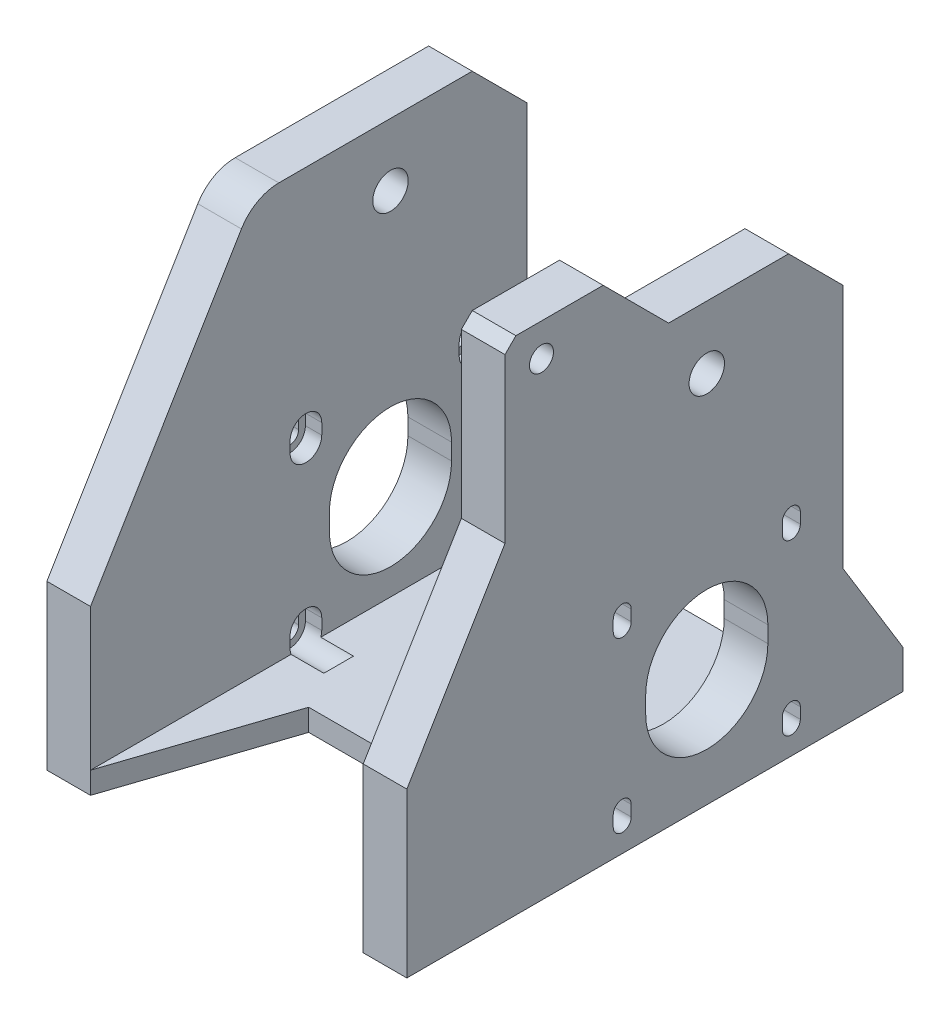
from build123d import *

# Parameters (mm, degrees)
EXTRUDE_1_DEPTH     = 50
SKETCH_3_R          = 6
CUT_EXTRUDE_1_DEPTH = 50
SKETCH_4_R          = 1.8
CUT_EXTRUDE_2_DEPTH = 28
CHAMFER_1_SIZE      = 1.5
CUT_EXTRUDE_3_DEPTH = 12
CUT_EXTRUDE_START   = -5
CUT_EXTRUDE_4_DEPTH = 9
SKETCH_10_R         = 3.25
CUT_EXTRUDE_5_DEPTH = 80
CHAMFER_2_SIZE      = 6
SKETCH_11_R         = 2.2
EXTRUDE_2_DEPTH     = 8
EXTRUDE_3_DEPTH     = 8
EXTRUDE_4_DEPTH     = 4
EXTRUDE_6_DEPTH     = 8
CHAMFER_3_SIZE      = 10
CHAMFER_4_SIZE      = 12
CHAMFER_5_SIZE      = 2
FILLET_1_R          = 8
SKETCH_17_R         = 4.05
CUT_EXTRUDE_6_DEPTH = 3
FILLET_2_R          = 0.5


with BuildPart() as part:
    # 草图1 → 凸台-拉伸1 (new body)
    with BuildSketch(Plane.XY):
        Polygon((33, 0), (-33, 0), (-33, 80), (-25, 80), (-25, 4), (25, 4), (25, 80), (33, 80), align=None)
    extrude(amount=EXTRUDE_1_DEPTH)

    # 草图3 → 切除-拉伸1 (cut)
    with BuildSketch(Plane.XZ):
        with Locations(Location((0, 25, 0), (0, 0, 270))):
            Circle(SKETCH_3_R)
    extrude(amount=-CUT_EXTRUDE_1_DEPTH, mode=Mode.SUBTRACT)

    # 草图4 → 切除-拉伸2 (cut)
    with BuildSketch(Plane.XZ):
        with Locations(Location((0, 40, 0), (0, 0, 270))):
            Circle(SKETCH_4_R)
        with Locations(Location((15, 25, 0), (0, 0, 270))):
            Circle(SKETCH_4_R)
        with Locations(Location((0, 10, 0), (0, 0, 270))):
            Circle(SKETCH_4_R)
        with Locations(Location((-15, 25, 0), (0, 0, 270))):
            Circle(SKETCH_4_R)
    extrude(amount=-CUT_EXTRUDE_2_DEPTH, mode=Mode.SUBTRACT)

    # 倒角1
    chamfer_1_edges = [part.edges().sort_by_distance(p)[0] for p in [
        (0, 4, 41.8),
        (15, 4, 26.8),
        (0, 4, 11.8),
        (-15, 4, 26.8),
    ]]
    chamfer(chamfer_1_edges, length=CHAMFER_1_SIZE)

    # 草图6 → 切除-拉伸3 (cut)
    with BuildSketch(Plane.ZY.offset(33)):
        with BuildLine():
            Line((13.8, 20), (13.8, 23))
            ThreePointArc((13.8, 23), (25, 34.2), (36.2, 23))
            Line((36.2, 23), (36.2, 20))
            ThreePointArc((36.2, 20), (25, 8.8), (13.8, 20))
        make_face()
        with BuildLine():
            Line((11.15, 38), (11.15, 36))
            ThreePointArc((11.15, 36), (9.5, 34.35), (7.85, 36))
            Line((7.85, 36), (7.85, 38))
            ThreePointArc((7.85, 38), (9.5, 39.65), (11.15, 38))
        make_face()
        with BuildLine():
            Line((38.85, 38), (38.85, 36))
            ThreePointArc((38.85, 36), (40.5, 34.35), (42.15, 36))
            Line((42.15, 36), (42.15, 38))
            ThreePointArc((42.15, 38), (40.5, 39.65), (38.85, 38))
        make_face()
        with BuildLine():
            Line((11.15, 5), (11.15, 7))
            ThreePointArc((11.15, 7), (9.5, 8.65), (7.85, 7))
            Line((7.85, 7), (7.85, 5))
            ThreePointArc((7.85, 5), (9.5, 3.35), (11.15, 5))
        make_face()
        with BuildLine():
            Line((38.85, 5), (38.85, 7))
            ThreePointArc((38.85, 7), (40.5, 8.65), (42.15, 7))
            Line((42.15, 7), (42.15, 5))
            ThreePointArc((42.15, 5), (40.5, 3.35), (38.85, 5))
        make_face()
    cut_extrude_3 = extrude(amount=-CUT_EXTRUDE_3_DEPTH, mode=Mode.SUBTRACT)

    # 草图9 → 切除-拉伸4 (cut)
    with BuildSketch(Plane.ZY.offset(33).offset(CUT_EXTRUDE_START)):
        with BuildLine():
            Line((12.4, 38), (12.4, 36))
            ThreePointArc((12.4, 36), (9.5, 33.1), (6.6, 36))
            Line((6.6, 36), (6.6, 38))
            ThreePointArc((6.6, 38), (9.5, 40.9), (12.4, 38))
        make_face()
        with BuildLine():
            Line((37.6, 38), (37.6, 36))
            ThreePointArc((37.6, 36), (40.5, 33.1), (43.4, 36))
            Line((43.4, 36), (43.4, 38))
            ThreePointArc((43.4, 38), (40.5, 40.9), (37.6, 38))
        make_face()
        with BuildLine():
            Line((37.6, 5), (37.6, 7))
            ThreePointArc((37.6, 7), (40.5, 9.9), (43.4, 7))
            Line((43.4, 7), (43.4, 5))
            ThreePointArc((43.4, 5), (40.5, 2.1), (37.6, 5))
        make_face()
        with BuildLine():
            Line((12.4, 5), (12.4, 7))
            ThreePointArc((12.4, 7), (9.5, 9.9), (6.6, 7))
            Line((6.6, 7), (6.6, 5))
            ThreePointArc((6.6, 5), (9.5, 2.1), (12.4, 5))
        make_face()
    cut_extrude_4 = extrude(amount=-CUT_EXTRUDE_4_DEPTH, mode=Mode.SUBTRACT)

    # 镜向1: 切除-拉伸3, 切除-拉伸4 across plane
    add(cut_extrude_3.mirror(Plane(origin=(0, 0, 0), x_dir=(0, 0, 1), z_dir=(1, 0, 0))), mode=Mode.SUBTRACT)
    add(cut_extrude_4.mirror(Plane(origin=(0, 0, 0), x_dir=(0, 0, 1), z_dir=(1, 0, 0))), mode=Mode.SUBTRACT)

    # 草图10 → 切除-拉伸5 (cut)
    with BuildSketch(Plane(origin=(33, 0, 0), x_dir=(0, 0, -1), z_dir=(1, 0, 0))):
        with Locations(Location((-25, 68.5, 0), (0, 0, 90))):
            Circle(SKETCH_10_R)
    extrude(amount=-CUT_EXTRUDE_5_DEPTH, mode=Mode.SUBTRACT)

    # 倒角2
    chamfer_2_edges = [part.edges().sort_by_distance(p)[0] for p in [
        (29, 80, 50),
    ]]
    chamfer(chamfer_2_edges, length=CHAMFER_2_SIZE)

    # 草图11 → 凸台-拉伸2 (add)
    with BuildSketch(Plane(origin=(33, 0, 0), x_dir=(0, 0, -1), z_dir=(1, 0, 0))):
        Polygon((-50, 63.445571485), (-50, 74), (-44, 80), (-44, 92), (-62, 92), (-62, 74), (-62, 54.790404535), (-50, 54.790404535), align=None)
        with Locations(Location((-55.310889132, 86, 0), (0, 0, 90))):
            Circle(SKETCH_11_R, mode=Mode.SUBTRACT)
    extrude(amount=-EXTRUDE_2_DEPTH)

    # 草图13 → 凸台-拉伸3 (add)
    with BuildSketch(Plane.ZY.offset(33)):
        Polygon((50, 80), (80, 30), (80, 0), (50, 0), align=None)
    extrude_3 = extrude(amount=-EXTRUDE_3_DEPTH)

    # 镜向2: 凸台-拉伸3 across plane
    add(extrude_3.mirror(Plane(origin=(0, 0, 0), x_dir=(0, 0, 1), z_dir=(1, 0, 0))))

    # 草图14 → 凸台-拉伸4 (add)
    with BuildSketch(Plane.XZ):
        Polygon((-25, 80), (-15, 50), (-25, 50), align=None)
    extrude_4 = extrude(amount=-EXTRUDE_4_DEPTH)

    # 镜向3: 凸台-拉伸4 across plane
    add(extrude_4.mirror(Plane(origin=(0, 0, 0), x_dir=(0, 0, 1), z_dir=(1, 0, 0))))

    # 草图16 → 凸台-拉伸6 (add)
    with BuildSketch(Plane.ZY.offset(33)):
        Polygon((0, 25), (-11, 7), (-11, 0), (0, 0), align=None)
    extrude_6 = extrude(amount=-EXTRUDE_6_DEPTH)

    # 镜向5: 凸台-拉伸6 across plane
    add(extrude_6.mirror(Plane(origin=(0, 0, 0), x_dir=(0, 0, 1), z_dir=(1, 0, 0))))

    # 倒角3
    chamfer_3_edges = [part.edges().sort_by_distance(p)[0] for p in [
        (29, 80, 0),
        (-29, 80, 0),
    ]]
    chamfer(chamfer_3_edges, length=CHAMFER_3_SIZE)

    # 倒角4
    chamfer_4_edges = [part.edges().sort_by_distance(p)[0] for p in [
        (29, 80, 44),
    ]]
    chamfer(chamfer_4_edges, length=CHAMFER_4_SIZE - 0.0001)  # a hair under: the kernel refuses the full size

    # 倒角5
    chamfer_5_edges = [part.edges().sort_by_distance(p)[0] for p in [
        (29, 92, 62),
    ]]
    chamfer(chamfer_5_edges, length=CHAMFER_5_SIZE)

    # 圆角1
    fillet_1_edges = [part.edges().sort_by_distance(p)[0] for p in [
        (-29, 80, 50),
    ]]
    fillet(fillet_1_edges, radius=FILLET_1_R)

    # 草图17 → 切除-拉伸6 (cut)
    with BuildSketch(Plane.ZY.offset(-25)):
        with Locations(Location((55.310889132, 86, 0), (0, 0, 270))):
            Circle(SKETCH_17_R)
    extrude(amount=-CUT_EXTRUDE_6_DEPTH, mode=Mode.SUBTRACT)

    # 圆角2
    fillet_2_edges = [part.edges().sort_by_distance(p)[0] for p in [
        (25, 90.05, 55.310889132),
    ]]
    fillet(fillet_2_edges, radius=FILLET_2_R)


solid = part.part
